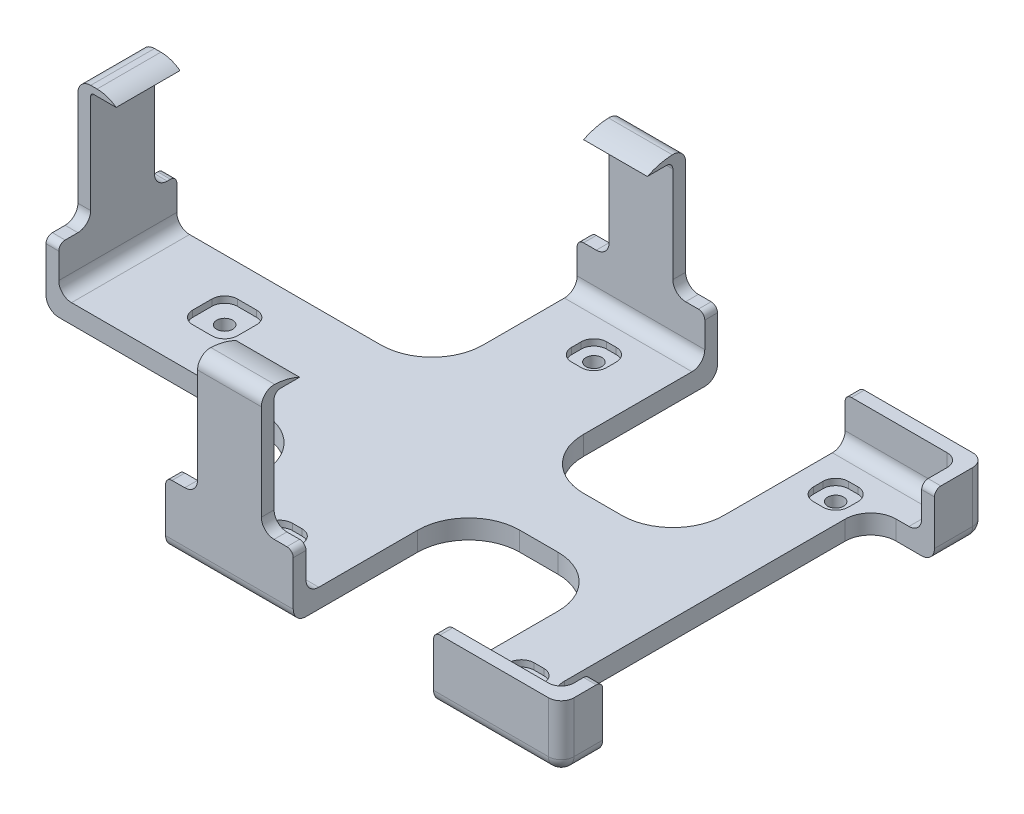
from build123d import *

# Parameters (mm, degrees)
SKETCH1_W               = 100
SKETCH1_H               = 62.5
BOSS_EXTRUDE1_DEPTH     = 3
SKETCH1_3_W             = 104
SKETCH1_3_H             = 66.5
SKETCH1_3_W_2           = 100
SKETCH1_3_H_2           = 62.5
BOSS_EXTRUDE2_DEPTH     = 10
SKETCH2_W               = 52
SKETCH2_H               = 10
CUT_EXTRUDE1_DEPTH      = 10
BOSS_EXTRUDE3_DEPTH     = 2
BOSS_EXTRUDE4_DEPTH     = 10
FILLET2_R               = 10
FILLET4_R               = 1
FILLET9_R               = 10
FILLET10_R              = 0.5
FILLET11_R              = 1
SKETCH10_W              = 10
SKETCH10_H              = 18
BOSS_EXTRUDE5_DEPTH     = 2
BOSS_EXTRUDE6_DEPTH     = 10
FILLET12_R              = 5
FILLET13_R              = 0.5
FILLET14_R              = 2
CUT_EXTRUDE2_DEPTH      = 124.451407444
FILLET15_R              = 8
FILLET16_R              = 8
CUT_EXTRUDE5_DEPTH      = 124.451407444
FILLET17_R              = 8
FILLET18_R              = 4
FILLET22_R              = 2
FILLET24_R              = 2
SKETCH21_W              = 7
SKETCH21_H              = 7
CUT_EXTRUDE6_DEPTH      = 1
SKETCH24_R              = 1.25
CUT_EXTRUDE8_DEPTH      = 124.665880501
FILLET25_R              = 2
SKETCH25_W              = 5.5
SKETCH25_H              = 5.5
CUT_EXTRUDE9_DEPTH      = 1
SKETCH26_R              = 1.25
CUT_EXTRUDE10_DEPTH     = 124.665880501
MIRROR9_COPY_1_SKETCH_W = 5.5
MIRROR9_COPY_1_SKETCH_H = 5.5
MIRROR9_COPY_1_DEPTH    = 1
MIRROR9_COPY_2_SKETCH_R = 1.25
MIRROR9_COPY_2_DEPTH    = 124.665880501
FILLET26_R              = 2
FILLET27_R              = 2
FILLET28_R              = 2
FILLET29_R              = 2
SKETCH29_W              = 42
SKETCH29_H              = 10
CUT_EXTRUDE12_DEPTH     = 10
CUT_EXTRUDE13_DEPTH     = 91.830886817
SKETCH35_W              = 10
SKETCH35_H              = 18
BOSS_EXTRUDE9_DEPTH     = 2
BOSS_EXTRUDE10_DEPTH    = 10
FILLET30_R              = 10
FILLET31_R              = 2
FILLET32_R              = 2
FILLET33_R              = 2
FILLET34_R              = 1
FILLET35_R              = 2
FILLET36_R              = 1


with BuildPart() as part:
    # Sketch1 → Boss-Extrude1 (new body)
    with BuildSketch(Plane(origin=(0, 0, 0), x_dir=(1, 0, 0), z_dir=(0, 1, 0))):
        with Locations((50, -31.25)):
            Rectangle(SKETCH1_W, SKETCH1_H)
    extrude(amount=BOSS_EXTRUDE1_DEPTH)

    # Sketch1<3> → Boss-Extrude2 (add)
    with BuildSketch(Plane(origin=(0, 0, 0), x_dir=(1, 0, 0), z_dir=(0, 1, 0))):
        with Locations((50, -31.25)):
            Rectangle(SKETCH1_3_W, SKETCH1_3_H)
        with Locations((50, -31.25)):
            Rectangle(SKETCH1_3_W_2, SKETCH1_3_H_2, mode=Mode.SUBTRACT)
    extrude(amount=BOSS_EXTRUDE2_DEPTH)

    # Sketch2 → Cut-Extrude1 (cut)
    with BuildSketch(Plane(origin=(102, 0, 0), x_dir=(0, 0, -1), z_dir=(1, 0, 0))):
        with Locations((-32, 5)):
            Rectangle(SKETCH2_W, SKETCH2_H)
    extrude(amount=-CUT_EXTRUDE1_DEPTH, mode=Mode.SUBTRACT)

    # Sketch5 → Boss-Extrude3 (add)
    with BuildSketch(Plane.XY.offset(64.5)):
        Polygon((50, 10), (45, 10), (45, 28), (55, 28), (55, 10), align=None)
    boss_extrude3 = extrude(amount=-BOSS_EXTRUDE3_DEPTH)

    # Sketch7 → Boss-Extrude4 (add)
    with BuildSketch(Plane(origin=(55, 0, 0), x_dir=(0, 0, -1), z_dir=(1, 0, 0))):
        Polygon((-62.5, 28), (-58.5, 28), (-58.5, 29), (-64.5, 29), (-64.5, 28), align=None)
    boss_extrude4 = extrude(amount=-BOSS_EXTRUDE4_DEPTH)

    # Fillet2
    # the kernel refuses this fillet: 10 mm, written as the material it takes off along each edge
    with BuildSketch(Plane(origin=(65.897247359, 29, 58.5), x_dir=(0, 0, 1), z_dir=(-1, 0, 0))) as fillet2_piece_1:
        with BuildLine():
            CenterArc((4.358898944, -10), FILLET2_R, 90, 25.841932763)
            Line((0, -1), (0, 0))
            Line((0, 0), (4.358898944, 0))
        make_face()
    extrude(amount=31.794494718, mode=Mode.SUBTRACT)

    # Fillet4
    fillet4_edges = [part.edges().sort_by_distance(p)[0] for p in [
        (50, 28, 62.5),
    ]]
    fillet(fillet4_edges, radius=FILLET4_R)

    # Mirror5: Boss-Extrude3, Boss-Extrude4 across plane
    add(boss_extrude3.mirror(Plane.XY.offset(32)))
    add(boss_extrude4.mirror(Plane.XY.offset(32)))

    # Fillet9
    # the kernel refuses this fillet: 10 mm, written as the material it takes off along each edge
    with BuildSketch(Plane(origin=(65.897247359, 29, 5.5), x_dir=(0, -1, 0), z_dir=(-1, 0, 0))) as fillet9_piece_1:
        with BuildLine():
            CenterArc((10, -4.358898944), FILLET9_R, 154.158067237, 25.841932763)
            Line((0, -4.358898944), (-0.2, -4.358898944))
            Line((-0.2, -4.358898944), (-0.2, 0))
            Line((-0.2, 0), (0, 0.2))
            ThreePointArc((0, 0.2), (0.5, 0.2), (0.82, 0.087177979))
            Line((0.82, 0.087177979), (1, 0))
        make_face()
    extrude(amount=31.794494718, mode=Mode.SUBTRACT)

    # Fillet10
    fillet10_edges = [part.edges().sort_by_distance(p)[0] for p in [
        (50, 28, 1.5),
    ]]
    fillet(fillet10_edges, radius=FILLET10_R)

    # Fillet11
    fillet11_edges = [part.edges().sort_by_distance(p)[0] for p in [
        (50, 29, -0.5),
    ]]
    fillet(fillet11_edges, radius=FILLET11_R)

    # Sketch10 → Boss-Extrude5 (add)
    with BuildSketch(Plane.ZY.offset(2)):
        with Locations((31.25, 19)):
            Rectangle(SKETCH10_W, SKETCH10_H)
    extrude(amount=-BOSS_EXTRUDE5_DEPTH)

    # Sketch11 → Boss-Extrude6 (add)
    with BuildSketch(Plane(origin=(0, 0, 26.25), x_dir=(-1, 0, 0), z_dir=(0, 0, -1))):
        Polygon((2, 28), (2, 29), (-4, 29), (-4, 28), (0, 28), align=None)
    extrude(amount=-BOSS_EXTRUDE6_DEPTH)

    # Fillet12
    # the kernel refuses this fillet: 5 mm, written as the material it takes off along each edge
    with BuildSketch(Plane(origin=(4, 29, 18.75), x_dir=(0, -1, 0), z_dir=(0, 0, 1))) as fillet12_piece_1:
        with BuildLine():
            CenterArc((5, -3), FILLET12_R, 143.130102354, 36.869897646)
            Line((0, -3), (-0.1, -3))
            Line((-0.1, -3), (-0.1, 0))
            Line((-0.1, 0), (0, 0.1))
            ThreePointArc((0, 0.1), (0.5, 0.1), (0.92, 0.06))
            Line((0.92, 0.06), (1, 0))
        make_face()
    extrude(amount=25, mode=Mode.SUBTRACT)

    # Fillet13
    fillet13_edges = [part.edges().sort_by_distance(p)[0] for p in [
        (0, 28, 31.25),
    ]]
    fillet(fillet13_edges, radius=FILLET13_R)

    # Fillet14
    fillet14_edges = [part.edges().sort_by_distance(p)[0] for p in [
        (-2, 29, 31.25),
    ]]
    fillet(fillet14_edges, radius=FILLET14_R)

    # Sketch14 → Cut-Extrude2 (cut, symmetric)
    with BuildSketch(Plane(origin=(0, 3, 0), x_dir=(1, 0, 0), z_dir=(0, 1, 0))):
        Polygon((40, -62.5), (40, -41.25), (0, -41.25), (-2, -41.25), (-2, -64.5), (40, -64.5), align=None)
    cut_extrude2 = extrude(amount=CUT_EXTRUDE2_DEPTH, both=True, mode=Mode.SUBTRACT)

    # Fillet15
    fillet15_edges = [part.edges().sort_by_distance(p)[0] for p in [
        (40, 1.5, 41.25),
    ]]
    fillet(fillet15_edges, radius=FILLET15_R)

    # Mirror6: Cut-Extrude2 across plane
    add(cut_extrude2.mirror(Plane.XY.offset(32)), mode=Mode.SUBTRACT)

    # Fillet16
    fillet16_edges = [part.edges().sort_by_distance(p)[0] for p in [
        (40, 1.5, 22.75),
    ]]
    fillet(fillet16_edges, radius=FILLET16_R)

    # Sketch17 → Cut-Extrude5 (cut, symmetric)
    with BuildSketch(Plane(origin=(0, 3, 0), x_dir=(1, 0, 0), z_dir=(0, 1, 0))):
        Polygon((60, 0), (60, -27), (82, -27), (82, 2), (60, 2), align=None)
    cut_extrude5 = extrude(amount=CUT_EXTRUDE5_DEPTH, both=True, mode=Mode.SUBTRACT)

    # Mirror7: Cut-Extrude5 across plane
    add(cut_extrude5.mirror(Plane.XY.offset(32)), mode=Mode.SUBTRACT)

    # Fillet17
    fillet17_edges = [part.edges().sort_by_distance(p)[0] for p in [
        (82, 1.5, 27),
        (60, 1.5, 27),
        (82, 1.5, 37),
        (60, 1.5, 37),
    ]]
    fillet(fillet17_edges, radius=FILLET17_R)

    # Fillet18
    fillet18_edges = [part.edges().sort_by_distance(p)[0] for p in [
        (92, 1.5, 58),
        (92, 1.5, 6),
    ]]
    fillet(fillet18_edges, radius=FILLET18_R)

    # Fillet22
    fillet22_edges = [part.edges().sort_by_distance(p)[0] for p in [
        (100, 6.5, 0),
        (100, 6.5, 62.5),
    ]]
    fillet(fillet22_edges, radius=FILLET22_R)

    # Fillet24
    fillet24_edges = [part.edges().sort_by_distance(p)[0] for p in [
        (102, 5, 64.5),
        (102, 5, -2),
    ]]
    fillet(fillet24_edges, radius=FILLET24_R)

    # Sketch21 → Cut-Extrude6 (cut)
    with BuildSketch(Plane(origin=(0, 3, 0), x_dir=(1, 0, 0), z_dir=(0, 1, 0))):
        with Locations((16, -31.25)):
            Rectangle(SKETCH21_W, SKETCH21_H)
    extrude(amount=-CUT_EXTRUDE6_DEPTH, mode=Mode.SUBTRACT)

    # Sketch24 → Cut-Extrude8 (cut, through all)
    with BuildSketch(Plane(origin=(0, 2, 0), x_dir=(1, 0, 0), z_dir=(0, 1, 0))):
        with Locations(Location((16, -31.25, 0), (0, 0, 270))):
            Circle(SKETCH24_R)
    extrude(amount=-CUT_EXTRUDE8_DEPTH, mode=Mode.SUBTRACT)

    # Fillet25
    fillet25_edges = [part.edges().sort_by_distance(p)[0] for p in [
        (19.5, 2.5, 34.75),
        (12.5, 2.5, 34.75),
        (12.5, 2.5, 27.75),
        (19.5, 2.5, 27.75),
    ]]
    fillet(fillet25_edges, radius=FILLET25_R)

    # Sketch25 → Cut-Extrude9 (cut)
    with BuildSketch(Plane(origin=(0, 3, 0), x_dir=(1, 0, 0), z_dir=(0, 1, 0))):
        with Locations((50, -7.375)):
            Rectangle(SKETCH25_W, SKETCH25_H)
    cut_extrude9 = extrude(amount=-CUT_EXTRUDE9_DEPTH, mode=Mode.SUBTRACT)

    # Sketch26 → Cut-Extrude10 (cut, through all)
    with BuildSketch(Plane(origin=(0, 2, 0), x_dir=(1, 0, 0), z_dir=(0, 1, 0))):
        with Locations(Location((50, -7.375, 0), (0, 0, 270))):
            Circle(SKETCH26_R)
    cut_extrude10 = extrude(amount=-CUT_EXTRUDE10_DEPTH, mode=Mode.SUBTRACT)

    # Mirror8: Cut-Extrude9, Cut-Extrude10 across plane
    add(cut_extrude9.mirror(Plane.ZY.offset(-68.944615124)), mode=Mode.SUBTRACT)
    add(cut_extrude10.mirror(Plane.ZY.offset(-68.944615124)), mode=Mode.SUBTRACT)

    # Mirror9: Cut-Extrude9, Cut-Extrude10 across plane
    add(cut_extrude9.mirror(Plane.XY.offset(32)), mode=Mode.SUBTRACT)
    add(cut_extrude10.mirror(Plane.XY.offset(32)), mode=Mode.SUBTRACT)

    # Mirror9 copy 1 sketch → Mirror9 copy 1 (cut)
    with BuildSketch(Plane(origin=(137.889230248, 3, 64), x_dir=(-1, 0, 0), z_dir=(0, 1, 0))):
        with Locations((50, -7.375)):
            Rectangle(MIRROR9_COPY_1_SKETCH_W, MIRROR9_COPY_1_SKETCH_H)
    extrude(amount=-MIRROR9_COPY_1_DEPTH, mode=Mode.SUBTRACT)

    # Mirror9 copy 2 sketch → Mirror9 copy 2 (cut, through all)
    with BuildSketch(Plane(origin=(137.889230248, 2, 64), x_dir=(-1, 0, 0), z_dir=(0, 1, 0))):
        with Locations(Location((50, -7.375, 0), (0, 0, 270))):
            Circle(MIRROR9_COPY_2_SKETCH_R)
    extrude(amount=-MIRROR9_COPY_2_DEPTH, mode=Mode.SUBTRACT)

    # Fillet26
    fillet26_edges = [part.edges().sort_by_distance(p)[0] for p in [
        (52.75, 2.5, 53.875),
        (52.75, 2.5, 59.375),
        (47.25, 2.5, 59.375),
        (47.25, 2.5, 53.875),
    ]]
    fillet(fillet26_edges, radius=FILLET26_R)

    # Fillet27
    fillet27_edges = [part.edges().sort_by_distance(p)[0] for p in [
        (52.75, 2.5, 4.625),
        (52.75, 2.5, 10.125),
        (47.25, 2.5, 10.125),
        (47.25, 2.5, 4.625),
    ]]
    fillet(fillet27_edges, radius=FILLET27_R)

    # Fillet28
    fillet28_edges = [part.edges().sort_by_distance(p)[0] for p in [
        (85.139230248, 2.5, 10.125),
        (85.139230248, 2.5, 4.625),
        (90.639230248, 2.5, 4.625),
        (90.639230248, 2.5, 10.125),
    ]]
    fillet(fillet28_edges, radius=FILLET28_R)

    # Fillet29
    fillet29_edges = [part.edges().sort_by_distance(p)[0] for p in [
        (85.139230248, 2.5, 59.375),
        (85.139230248, 2.5, 53.875),
        (90.639230248, 2.5, 53.875),
        (90.639230248, 2.5, 59.375),
    ]]
    fillet(fillet29_edges, radius=FILLET29_R)

    # Sketch29 → Cut-Extrude12 (cut)
    with BuildSketch(Plane.XY.offset(-0.5)):
        with Locations((19, 5)):
            Rectangle(SKETCH29_W, SKETCH29_H)
    extrude(amount=-CUT_EXTRUDE12_DEPTH, mode=Mode.SUBTRACT)

    # Sketch32 → Cut-Extrude13 (cut, through all)
    with BuildSketch(Plane.ZY.offset(-45)):
        with BuildLine():
            Line((1.141101056, 29), (0.5, 29))
            ThreePointArc((0.5, 29), (-0.207106781, 28.707106781), (-0.5, 28))
            Line((-0.5, 28), (-0.5, 10))
            Line((-0.5, 10), (0, 10))
            Line((0, 10), (1.5, 10))
            Line((1.5, 10), (1.5, 27.5))
            ThreePointArc((1.5, 27.5), (1.646446609, 27.853553391), (2, 28))
            Line((2, 28), (5.5, 28))
            ThreePointArc((5.5, 28), (3.377169034, 28.746794345), (1.141101056, 29))
        make_face()
    extrude(amount=-CUT_EXTRUDE13_DEPTH, mode=Mode.SUBTRACT)

    # Sketch35 → Boss-Extrude9 (add)
    with BuildSketch(Plane(origin=(0, 0, -2), x_dir=(-1, 0, 0), z_dir=(0, 0, -1))):
        with Locations((-50, 19)):
            Rectangle(SKETCH35_W, SKETCH35_H)
    extrude(amount=-BOSS_EXTRUDE9_DEPTH)

    # Sketch36 → Boss-Extrude10 (add)
    with BuildSketch(Plane.ZY.offset(-45)):
        Polygon((-2, 28), (-2, 29), (4, 29), (4, 28), (0, 28), align=None)
    extrude(amount=-BOSS_EXTRUDE10_DEPTH)

    # Fillet30
    # the kernel refuses this fillet: 10 mm, written as the material it takes off along each edge
    with BuildSketch(Plane(origin=(34.102752641, 29, 4), x_dir=(0, -1, 0), z_dir=(1, 0, 0))) as fillet30_piece_1:
        with BuildLine():
            CenterArc((10, 4.358898944), FILLET30_R, 180, 25.841932763)
            Line((0, 4.358898944), (-0.2, 4.358898944))
            Line((-0.2, 4.358898944), (-0.2, 0))
            Line((-0.2, 0), (0, -0.2))
            ThreePointArc((0, -0.2), (0.5, -0.2), (0.82, -0.087177979))
            Line((0.82, -0.087177979), (1, 0))
        make_face()
    extrude(amount=31.794494718, mode=Mode.SUBTRACT)

    # Fillet31
    fillet31_edges = [part.edges().sort_by_distance(p)[0] for p in [
        (50, 3, 62.5),
        (0, 3, 32),
        (50, 3, 0),
        (90, 3, 62.5),
        (100, 3, 59.25),
        (90, 3, 0),
        (99.414213562, 3, 0.585786438),
        (99.414213562, 3, 61.914213562),
        (100, 3, 4),
    ]]
    fillet(fillet31_edges, radius=FILLET31_R)

    # Fillet32
    fillet32_edges = [part.edges().sort_by_distance(p)[0] for p in [
        (50, 29, -2),
        (50, 29, 64.5),
    ]]
    fillet(fillet32_edges, radius=FILLET32_R)

    # Fillet33
    fillet33_edges = [part.edges().sort_by_distance(p)[0] for p in [
        (50, 0, 64.5),
        (-2, 0, 32),
        (50, 0, -2),
        (91, 0, 64.5),
        (102, 0, 60.25),
        (91, 0, -2),
        (101.414213562, 0, -1.414213562),
        (101.414213562, 0, 63.914213562),
        (102, 0, 3),
    ]]
    fillet(fillet33_edges, radius=FILLET33_R)

    # Fillet34
    fillet34_edges = [part.edges().sort_by_distance(p)[0] for p in [
        (-1, 10, 41.25),
        (40, 10, 63.5),
        (40, 10, -1),
        (-1, 10, 22.75),
        (82, 10, -1),
        (60, 10, -1),
        (60, 10, 63.5),
        (82, 10, 63.5),
        (101, 10, 58),
        (101, 10, 6),
    ]]
    fillet(fillet34_edges, radius=FILLET34_R)

    # Fillet35
    fillet35_edges = [part.edges().sort_by_distance(p)[0] for p in [
        (-1, 10, 26.25),
        (-1, 10, 36.25),
        (55, 10, 63.5),
        (45, 10, 63.5),
        (45, 10, -1),
        (55, 10, -1),
    ]]
    fillet(fillet35_edges, radius=FILLET35_R)

    # Fillet36
    fillet36_edges = [part.edges().sort_by_distance(p)[0] for p in [
        (50, 28, 0),
    ]]
    fillet(fillet36_edges, radius=FILLET36_R)


solid = part.part
